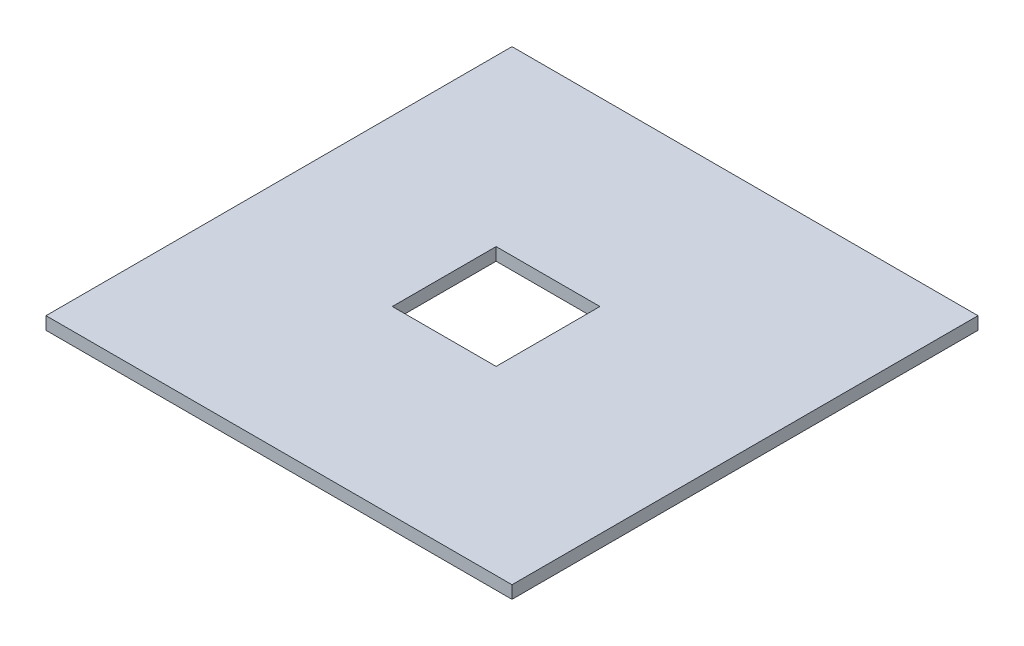
from build123d import *

# Parameters (mm, degrees)
SKETCH2_W           = 220
SKETCH2_H           = 220
BOSS_EXTRUDE1_DEPTH = 6
SKETCH3_W           = 49
SKETCH3_H           = 49
CUT_EXTRUDE1_DEPTH  = 10


with BuildPart() as part:
    # Sketch2 → Boss-Extrude1 (new body)
    with BuildSketch(Plane(origin=(0, 0, 0), x_dir=(1, 0, 0), z_dir=(0, 1, 0))):
        with Locations((-604.222894392, 102.339948834)):
            Rectangle(SKETCH2_W, SKETCH2_H)
    extrude(amount=BOSS_EXTRUDE1_DEPTH)

    # Sketch3 → Cut-Extrude1 (cut)
    with BuildSketch(Plane(origin=(0, 6, 0), x_dir=(1, 0, 0), z_dir=(0, 1, 0))):
        with Locations((-611.722894392, 102.339948834)):
            Rectangle(SKETCH3_W, SKETCH3_H)
    extrude(amount=-CUT_EXTRUDE1_DEPTH, mode=Mode.SUBTRACT)


solid = part.part
